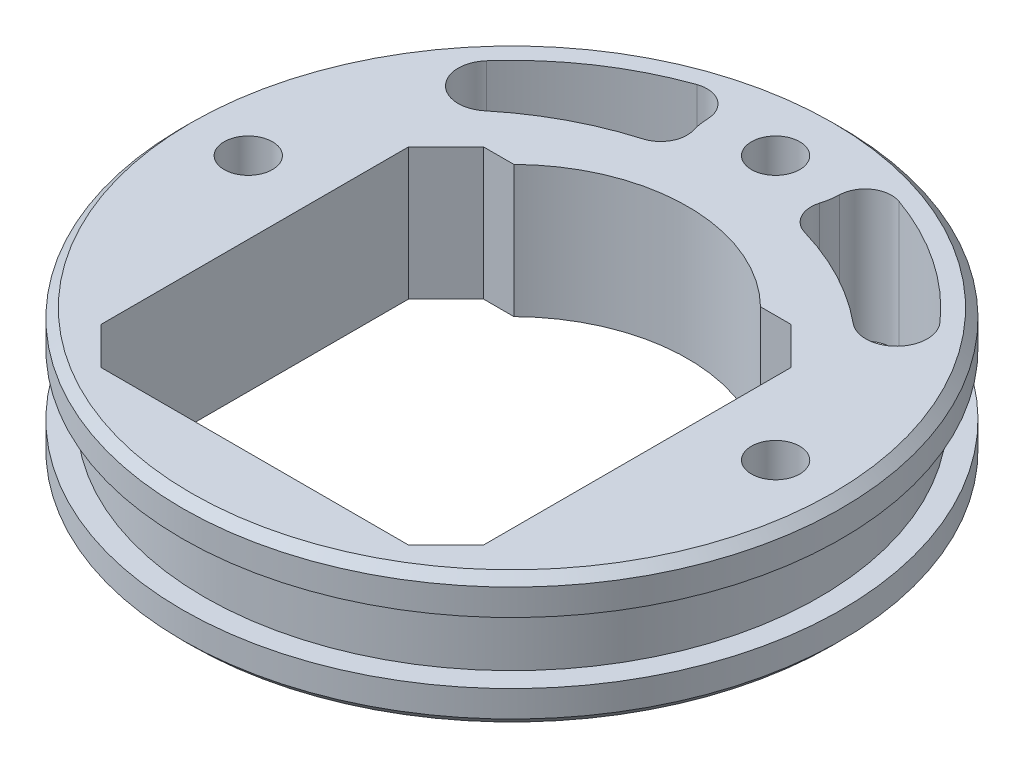
from build123d import *

# Parameters (mm, degrees)
SKETCH1_R               = 37.5
SKETCH1_R_2             = 2.75
BOSS_EXTRUDE1_DEPTH     = 7.5
SKETCH2_R               = 45
SKETCH2_R_2             = 35
CUT_EXTRUDE_THIN1_DEPTH = 3.5
CHAMFER1_SIZE           = 1


with BuildPart() as part:
    # Sketch1 → Boss-Extrude1 (new, symmetric)
    with BuildSketch(Plane(origin=(0, 0, 0), x_dir=(1, 0, 0), z_dir=(0, 1, 0))):
        Circle(SKETCH1_R)
        with Locations((0, 30)):
            Circle(SKETCH1_R_2, mode=Mode.SUBTRACT)
        with Locations((30, 0)):
            Circle(SKETCH1_R_2, mode=Mode.SUBTRACT)
        with Locations((-30, 0)):
            Circle(SKETCH1_R_2, mode=Mode.SUBTRACT)
        with BuildLine():
            Line((-17.494426356, 14.25), (-14.033442201, 14.25))
            ThreePointArc((-14.033442201, 14.25), (0, 20), (14.033442201, 14.25))
            Line((14.033442201, 14.25), (17.494426356, 14.25))
            Line((17.494426356, 14.25), (21.75, 9.994426356))
            Line((21.75, 9.994426356), (21.75, -24.994426356))
            Line((21.75, -24.994426356), (17.494426356, -29.25))
            Line((17.494426356, -29.25), (-17.494426356, -29.25))
            Line((-17.494426356, -29.25), (-21.75, -24.994426356))
            Line((-21.75, -24.994426356), (-21.75, 9.994426356))
            Line((-21.75, 9.994426356), (-17.494426356, 14.25))
        make_face(mode=Mode.SUBTRACT)
        with BuildLine():
            ThreePointArc((7.182286097, 27.840192967), (7.403794259, 28.802573354), (7.496938151, 29.785714286))
            ThreePointArc((7.496938151, 29.785714286), (8.798657136, 32.173863375), (11.495305164, 32.528571429))
            ThreePointArc((11.495305164, 32.528571429), (19.261751293, 28.622280432), (25.805142244, 22.898572746))
            ThreePointArc((25.805142244, 22.898572746), (25.70559409, 18.144924559), (20.958464106, 17.876898763))
            ThreePointArc((20.958464106, 17.876898763), (15.403995181, 21.585411137), (9.215229657, 24.09626166))
            ThreePointArc((9.215229657, 24.09626166), (7.418794885, 25.54470973), (7.182286097, 27.840192967))
        make_face(mode=Mode.SUBTRACT)
        with BuildLine():
            ThreePointArc((-25.805142244, 22.898572746), (-25.70559409, 18.144924559), (-20.958464106, 17.876898763))
            ThreePointArc((-20.958464106, 17.876898763), (-15.403995181, 21.585411137), (-9.215229657, 24.09626166))
            ThreePointArc((-9.215229657, 24.09626166), (-7.418794885, 25.54470973), (-7.182286097, 27.840192967))
            ThreePointArc((-7.182286097, 27.840192967), (-7.403794259, 28.802573354), (-7.496938151, 29.785714286))
            ThreePointArc((-7.496938151, 29.785714286), (-8.798657136, 32.173863375), (-11.495305164, 32.528571429))
            ThreePointArc((-11.495305164, 32.528571429), (-19.261751293, 28.622280432), (-25.805142244, 22.898572746))
        make_face(mode=Mode.SUBTRACT)
    extrude(amount=BOSS_EXTRUDE1_DEPTH, both=True)

    # Sketch2 → Cut-Extrude-Thin1 (cut, symmetric)
    with BuildSketch(Plane(origin=(0, 0, 0), x_dir=(1, 0, 0), z_dir=(0, 1, 0))):
        Circle(SKETCH2_R)
        Circle(SKETCH2_R_2, mode=Mode.SUBTRACT)
    extrude(amount=CUT_EXTRUDE_THIN1_DEPTH, both=True, mode=Mode.SUBTRACT)

    # Chamfer1
    chamfer1_edges = [part.edges().sort_by_distance(p)[0] for p in [
        (-37.5, -7.5, 0),
        (-37.5, 7.5, 0),
    ]]
    chamfer(chamfer1_edges, length=CHAMFER1_SIZE)


solid = part.part
